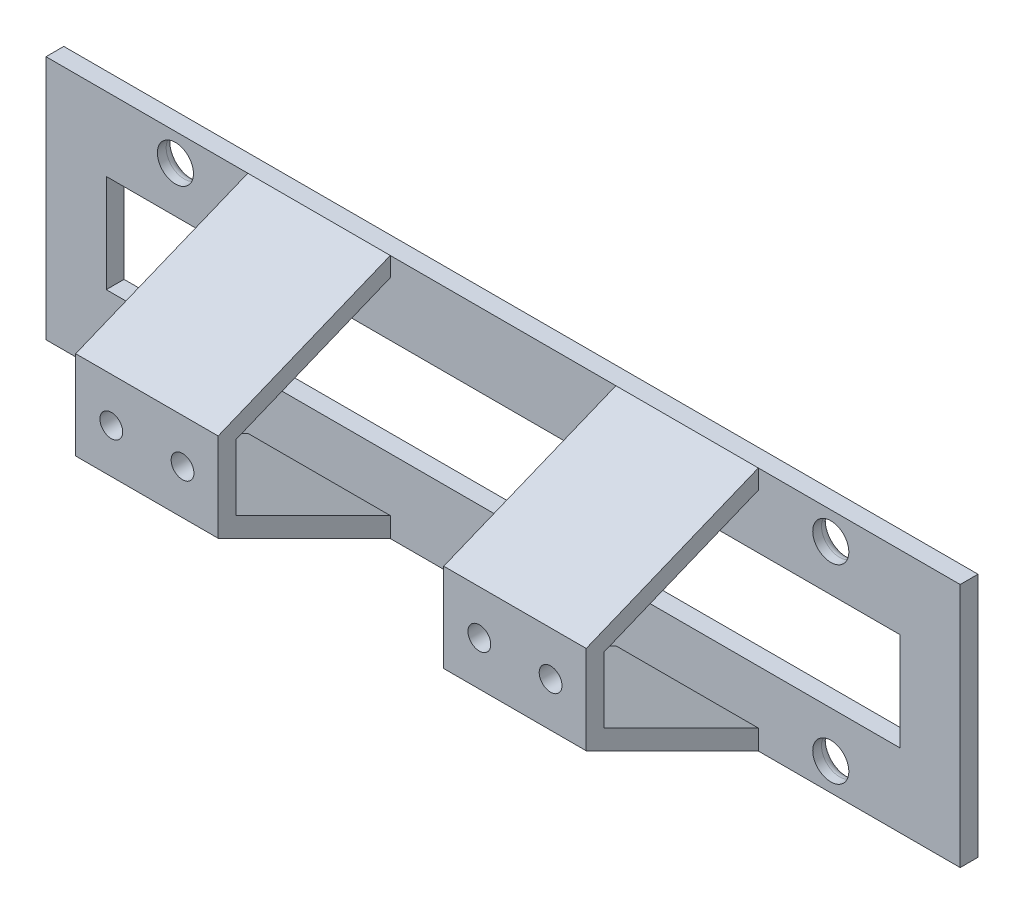
from build123d import *

# Parameters (mm, degrees)
SKETCH1_W                      = 77
SKETCH1_H                      = 20.65
SKETCH1_W_2                    = 66.85
SKETCH1_H_2                    = 8.26
BOSS_EXTRUDE1_DEPTH            = 1.5
CUT_EXTRUDE1_REACH             = 41.889
SKETCH2_R                      = 1.52
CUT_EXTRUDE1_DIRECTION_2_DEPTH = 40.88866537
FILLET1_R                      = 0.76
FILLET1_OF_MIRROR1_R           = 0.76
BOSS_EXTRUDE2_REACH            = 79.704
CUT_EXTRUDE2_START             = -20.65
CUT_EXTRUDE2_OUTLINE_W         = 19
CUT_EXTRUDE2_OUTLINE_H         = 14.5
CUT_EXTRUDE2_OUTLINE_W_2       = 17
CUT_EXTRUDE2_DEPTH             = 20.65
CUT_EXTRUDE3_REACH             = 44.952
SKETCH5_R                      = 0.96


# Read off the part's stored shape, not the designer's step: Mirror2, Cut-Extrude2
with BuildPart() as part:
    # Sketch1 → Boss-Extrude1 (new body)
    with BuildSketch(Plane.XY):
        Rectangle(SKETCH1_W, SKETCH1_H)
        Rectangle(SKETCH1_W_2, SKETCH1_H_2, mode=Mode.SUBTRACT)
    extrude(amount=BOSS_EXTRUDE1_DEPTH)

    # Sketch2 → Cut-Extrude1 (cut, up to next)
    with BuildSketch(Plane.XY.offset(1.5), mode=Mode.PRIVATE) as cut_extrude1_sk1:
        with Locations(Location((-27.6, 8.005, 0), (0, 0, 180))):
            Circle(SKETCH2_R)
    cut_extrude1_tool1 = extrude(cut_extrude1_sk1.sketch, amount=-CUT_EXTRUDE1_REACH, mode=Mode.PRIVATE) & part.part
    cut_extrude1 = cut_extrude1_tool1.solids().sort_by_distance((-27.6, 8.005, 1.5))[0]
    add(cut_extrude1, mode=Mode.SUBTRACT)

    # Sketch2 → Cut-Extrude1 direction 2 (cut)
    with BuildSketch(Plane.XY.offset(1.5)):
        with Locations(Location((-27.6, 8.005, 0), (0, 0, 180))):
            Circle(SKETCH2_R)
    cut_extrude1_direction_2 = extrude(amount=CUT_EXTRUDE1_DIRECTION_2_DEPTH, mode=Mode.SUBTRACT)

    # Fillet1
    fillet1_edges = [part.edges().sort_by_distance(p)[0] for p in [
        (-26.08, 8.005, 0),
    ]]
    fillet(fillet1_edges, radius=FILLET1_R)

    # Mirror1: Cut-Extrude1, Cut-Extrude1 direction 2 across plane
    add(cut_extrude1.mirror(Plane.ZX), mode=Mode.SUBTRACT)
    add(cut_extrude1_direction_2.mirror(Plane.ZX), mode=Mode.SUBTRACT)

    # Fillet1 of Mirror1
    fillet1_of_mirror1_edges = [part.edges().sort_by_distance(p)[0] for p in [
        (-26.08, -8.005, 0),
    ]]
    fillet(fillet1_of_mirror1_edges, radius=FILLET1_OF_MIRROR1_R)

    # Mirror2 outline → Mirror2 (revolve, cut)
    with BuildSketch(Plane(origin=(27.6, 8.005, 0), x_dir=(1, 0, 0), z_dir=(0, -1, 0))):
        with BuildLine():
            Line((1.52, 0.76), (1.52, 1.5))
            Line((1.52, 1.5), (0, 1.5))
            Line((0, 1.5), (0, 0))
            Line((0, 0), (2.28, 0))
            ThreePointArc((2.28, 0), (1.742598846, 0.222598846), (1.52, 0.76))
        make_face()
    revolve(axis=Axis((27.6, 8.005, 0), (0, 0, 1)), mode=Mode.SUBTRACT)

    # Mirror2 2 outline → Mirror2 2 (revolve, cut)
    with BuildSketch(Plane(origin=(27.6, -8.005, 0), x_dir=(1, 0, 0), z_dir=(0, -1, 0))):
        with BuildLine():
            Line((1.52, 0.76), (1.52, 1.5))
            Line((1.52, 1.5), (0, 1.5))
            Line((0, 1.5), (0, 0))
            Line((0, 0), (2.28, 0))
            ThreePointArc((2.28, 0), (1.742598846, 0.222598846), (1.52, 0.76))
        make_face()
    revolve(axis=Axis((27.6, -8.005, 0), (0, 0, 1)), mode=Mode.SUBTRACT)

    # Boss-Extrude2: up to this face of the body (flat: up to its plane)
    boss_extrude2_end = Plane(part.part.faces().sort_by_distance((38.5, 0, 0.75))[0])
    # Sketch3 → Boss-Extrude2 (add, up to the picked face)
    with BuildSketch(Plane.ZY.offset(38.5), mode=Mode.PRIVATE) as boss_extrude2_sk1:
        Polygon((16, 4.410137364), (1.5, 10.325), (1.5, 8.705), (14.5, 3.402019706), (14.5, -2.130032078), (1.5, -8.647068966), (1.5, -10.325), (16, -3.055997317), align=None)
    boss_extrude2_tool1 = split(extrude(boss_extrude2_sk1.sketch, amount=-BOSS_EXTRUDE2_REACH, mode=Mode.PRIVATE), bisect_by=boss_extrude2_end, keep=Keep.BOTH, mode=Mode.PRIVATE)
    add(boss_extrude2_tool1.solids().sort_by(Axis((-38.5, 0.67707, 15.747676), (1, 0, 0)))[0])

    # Cut-Extrude2 outline → Cut-Extrude2 (cut)
    with BuildSketch(Plane(origin=(0, 10.325, 0), x_dir=(1, 0, 0), z_dir=(0, 1, 0)).offset(CUT_EXTRUDE2_START)):
        with Locations((0, -8.75)):
            Rectangle(CUT_EXTRUDE2_OUTLINE_W, CUT_EXTRUDE2_OUTLINE_H)
        with Locations((30, -8.75)):
            Rectangle(CUT_EXTRUDE2_OUTLINE_W_2, CUT_EXTRUDE2_OUTLINE_H)
        with Locations((-30, -8.75)):
            Rectangle(CUT_EXTRUDE2_OUTLINE_W_2, CUT_EXTRUDE2_OUTLINE_H)
    extrude(amount=CUT_EXTRUDE2_DEPTH, mode=Mode.SUBTRACT)

    # Sketch5 → Cut-Extrude3 (cut, up to next)
    with BuildSketch(Plane.XY.offset(16), mode=Mode.PRIVATE) as cut_extrude3_sk1:
        with Locations((-12.5, 0.677070023)):
            Circle(SKETCH5_R)
    cut_extrude3_tool1 = extrude(cut_extrude3_sk1.sketch, amount=-CUT_EXTRUDE3_REACH, mode=Mode.PRIVATE) & part.part
    # Sketch5 → Cut-Extrude3 (cut, up to next)
    with BuildSketch(Plane.XY.offset(16), mode=Mode.PRIVATE) as cut_extrude3_sk2:
        with Locations((-18.5, 0.677070023)):
            Circle(SKETCH5_R)
    cut_extrude3_tool2 = extrude(cut_extrude3_sk2.sketch, amount=-CUT_EXTRUDE3_REACH, mode=Mode.PRIVATE) & part.part
    cut_extrude3_1 = cut_extrude3_tool1.solids().sort_by_distance((-12.5, 0.67707, 16))[0]
    add(cut_extrude3_1, mode=Mode.SUBTRACT)
    cut_extrude3_2 = cut_extrude3_tool2.solids().sort_by_distance((-18.5, 0.67707, 16))[0]
    add(cut_extrude3_2, mode=Mode.SUBTRACT)
    cut_extrude3 = cut_extrude3_1 + cut_extrude3_2  # Cut-Extrude3 as one shape, for the pattern or mirror that repeats it

    # Mirror3: Cut-Extrude3 across plane
    add(cut_extrude3.mirror(Plane(origin=(0, 0, 0), x_dir=(0, 0, 1), z_dir=(1, 0, 0))), mode=Mode.SUBTRACT)


solid = part.part
